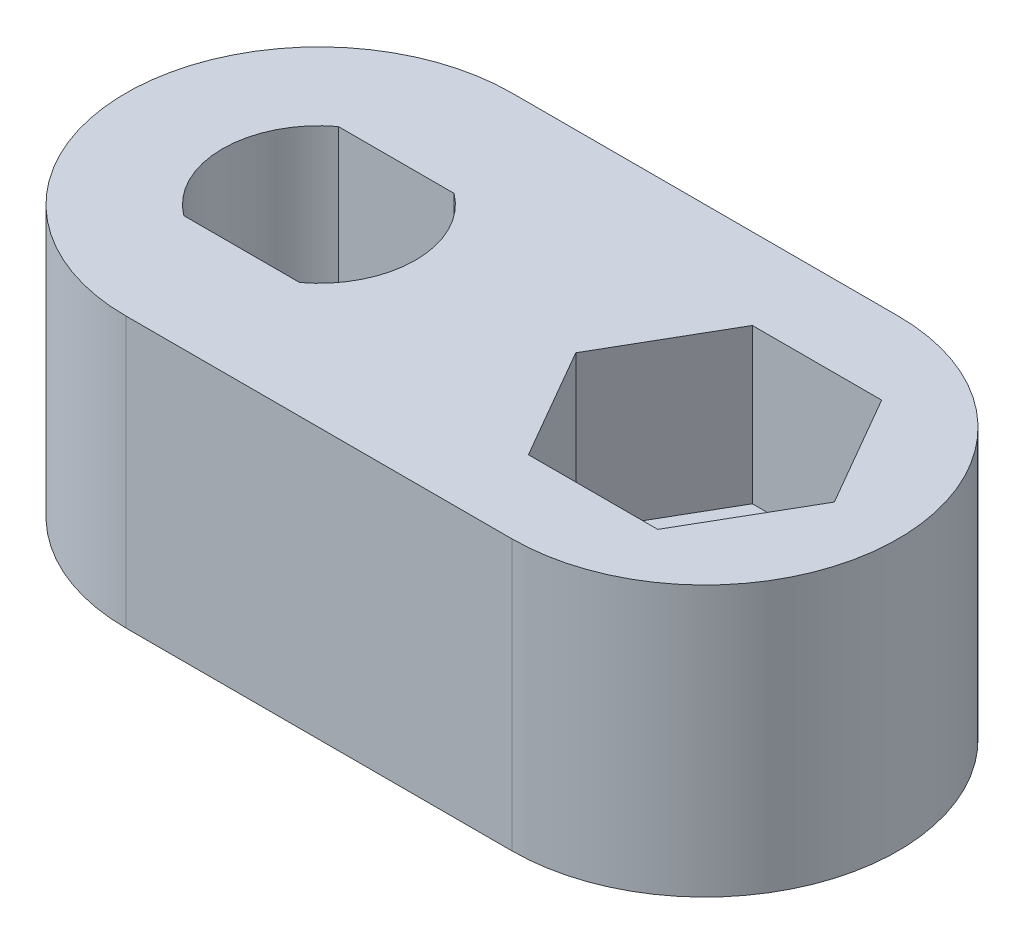
from build123d import *

# Parameters (mm, degrees)
BOSS_EXTRUDE1_DEPTH                                  = 7
CUT_EXTRUDE1_DEPTH                                   = 4
CSK_FOR_M3_HEX_SOCKET_COUNTERSUNK_CAP_SC_D           = 3.4
CSK_FOR_M3_HEX_SOCKET_COUNTERSUNK_CAP_SC_DEPTH       = 7.5
CSK_FOR_M3_HEX_SOCKET_COUNTERSUNK_CAP_SC_CSINK_D     = 6.72
CSK_FOR_M3_HEX_SOCKET_COUNTERSUNK_CAP_SC_CSINK_ANGLE = 90
CSK_FOR_M3_HEX_SOCKET_COUNTERSUNK_CAP_SC_TIP         = 1.021463052
HOLE1_D                                              = 4.15
CUT_EXTRUDE2_DEPTH                                   = 4


with BuildPart() as part:
    # Sketch1 → Boss-Extrude1 (new body)
    with BuildSketch(Plane(origin=(0, 0, 0), x_dir=(1, 0, 0), z_dir=(0, 1, 0))):
        with BuildLine():
            Line((0, 5), (10, 5))
            ThreePointArc((10, 5), (15, 0), (10, -5))
            Line((10, -5), (0, -5))
            ThreePointArc((0, -5), (-5, 0), (0, 5))
        make_face()
    extrude(amount=BOSS_EXTRUDE1_DEPTH)

    # Sketch2 → Cut-Extrude1 (cut)
    with BuildSketch(Plane(origin=(0, 7, 0), x_dir=(1, 0, 0), z_dir=(0, 1, 0))):
        with BuildLine():
            ThreePointArc((-1.5, 2), (-2.5, 0), (-1.5, -2))
            Line((-1.5, -2), (1.5, -2))
            ThreePointArc((1.5, -2), (2.236067977, -1.118033989), (2.5, 0))
            ThreePointArc((2.5, 0), (2.236067977, 1.118033989), (1.5, 2))
            Line((1.5, 2), (-1.5, 2))
        make_face()
    extrude(amount=-CUT_EXTRUDE1_DEPTH, mode=Mode.SUBTRACT)

    # CSK for M3 Hex Socket Countersunk Cap Screw2
    with Locations(Plane(origin=(0, 0, 0), x_dir=(-1, 0, 0), z_dir=(0, -1, 0))):
        with Locations((0, 0)):
            CounterSinkHole(CSK_FOR_M3_HEX_SOCKET_COUNTERSUNK_CAP_SC_D / 2, CSK_FOR_M3_HEX_SOCKET_COUNTERSUNK_CAP_SC_CSINK_D / 2, depth=CSK_FOR_M3_HEX_SOCKET_COUNTERSUNK_CAP_SC_DEPTH, counter_sink_angle=CSK_FOR_M3_HEX_SOCKET_COUNTERSUNK_CAP_SC_CSINK_ANGLE)
            with Locations((0, 0, -(CSK_FOR_M3_HEX_SOCKET_COUNTERSUNK_CAP_SC_DEPTH + CSK_FOR_M3_HEX_SOCKET_COUNTERSUNK_CAP_SC_TIP / 2))):  # 118° drill point
                Cone(0, CSK_FOR_M3_HEX_SOCKET_COUNTERSUNK_CAP_SC_D / 2, CSK_FOR_M3_HEX_SOCKET_COUNTERSUNK_CAP_SC_TIP, mode=Mode.SUBTRACT)

    # Hole1 (through all)
    with Locations(Plane(origin=(0, 0, 0), x_dir=(-1, 0, 0), z_dir=(0, -1, 0))):
        with Locations((-10, 0)):
            Hole(HOLE1_D / 2)

    # Sketch11 → Cut-Extrude2 (cut)
    with BuildSketch(Plane(origin=(0, 7, 0), x_dir=(1, 0, 0), z_dir=(0, 1, 0))):
        Polygon((13.348631561, 0), (11.674315781, 2.9), (8.325684219, 2.9), (6.651368439, 0), (8.325684219, -2.9), (11.674315781, -2.9), align=None)
    extrude(amount=-CUT_EXTRUDE2_DEPTH, mode=Mode.SUBTRACT)


solid = part.part
